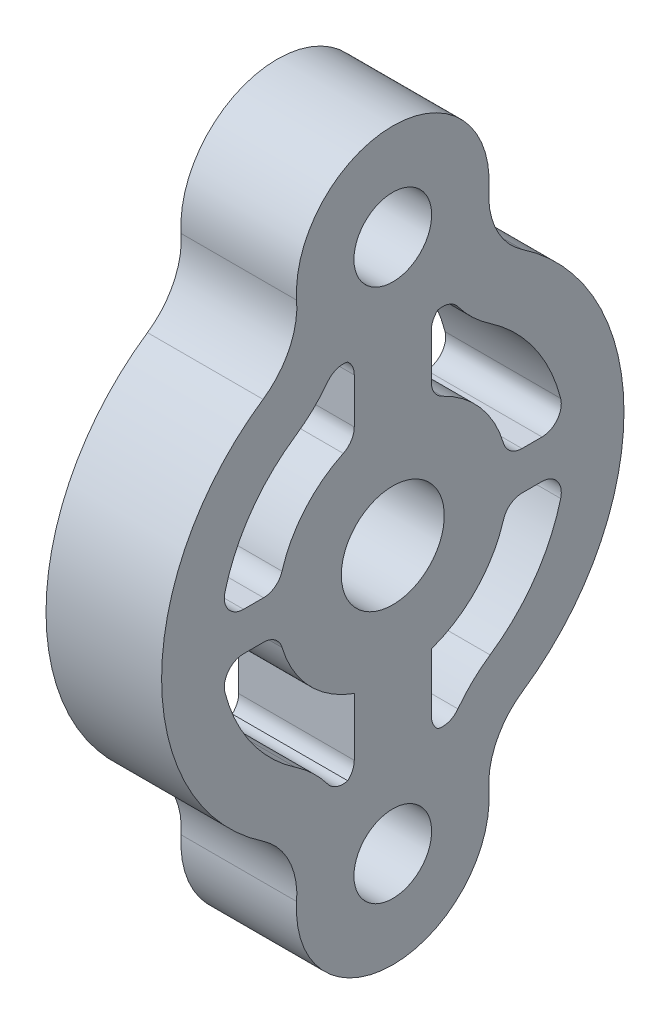
from build123d import *

# Parameters (mm, degrees)
SKETCH1_R           = 2.1209000000000002
SKETCH1_R_2         = 1.6002
BOSS_EXTRUDE1_DEPTH = 4.7625
CUT_EXTRUDE1_DEPTH  = 19.370370377662503
FILLET1_R           = 0.79375


with BuildPart() as part:
    # Sketch1 → Boss-Extrude1 (new body)
    with BuildSketch(Plane(origin=(0, 0, 0), x_dir=(0, 0, -1), z_dir=(1, 0, 0))):
        with BuildLine():
            ThreePointArc((-3.9594667824617957, 10.7287079782197), (2.8e-15, 14.96875), (3.9594667824617935, 10.728707978219694))
            ThreePointArc((3.9594667824617935, 10.728707978219694), (4.272672724168048, 9.121274682724051), (5.345280156323423, 7.883755770596593))
            ThreePointArc((5.345280156323423, 7.883755770596593), (9.525, 1.06e-15), (5.345280156323425, -7.883755770596589))
            ThreePointArc((5.345280156323425, -7.883755770596589), (4.272672724168048, -9.12127468272405), (3.9594667824617975, -10.728707978219694))
            ThreePointArc((3.9594667824617975, -10.728707978219694), (2.8e-15, -14.968749999999996), (-3.9594667824617917, -10.7287079782197))
            ThreePointArc((-3.9594667824617917, -10.7287079782197), (-4.272672724168042, -9.121274682724055), (-5.345280156323421, -7.883755770596593))
            ThreePointArc((-5.345280156323421, -7.883755770596593), (-9.524999999999999, -3.06e-15), (-5.345280156323423, 7.883755770596589))
            ThreePointArc((-5.345280156323423, 7.883755770596589), (-4.272672724168045, 9.121274682724053), (-3.9594667824617957, 10.7287079782197))
        make_face()
        with Locations(Location((0, 0, 0), (0, 0, 180))):
            Circle(SKETCH1_R, mode=Mode.SUBTRACT)
        with Locations(Location((0, 11, 0), (0, 0, 180))):
            Circle(SKETCH1_R_2, mode=Mode.SUBTRACT)
        with Locations(Location((0, -11, 0), (0, 0, 180))):
            Circle(SKETCH1_R_2, mode=Mode.SUBTRACT)
    extrude(amount=BOSS_EXTRUDE1_DEPTH)

    # Sketch2 → Cut-Extrude1 (cut, through all)
    with BuildSketch(Plane(origin=(4.7625, 0, 0), x_dir=(0, 0, -1), z_dir=(1, 0, 0))):
        with BuildLine():
            Line((-1.5875000000000001, -7.362580542128799), (-1.5874999999999997, -4.490128060534577))
            ThreePointArc((-1.5874999999999997, -4.490128060534577), (-3.6450027313013944, -3.0651853677722936), (-4.69588832783532, -0.7937500000000003))
            Line((-4.69588832783532, -0.7937500000000003), (-7.09951582856183, -0.7937500000000006))
            ThreePointArc((-7.09951582856183, -0.7937500000000006), (-6.115616956356625, -3.692207104920213), (-4.008960117242562, -5.912816827947443))
            ThreePointArc((-4.008960117242562, -5.912816827947443), (-3.046958974664247, -6.740089655613493), (-2.2977150650912916, -7.764033059168784))
            ThreePointArc((-2.2977150650912916, -7.764033059168784), (-1.9529503466198308, -7.545009188704331), (-1.5875000000000001, -7.362580542128799))
        make_face()
        with BuildLine():
            Line((1.5875000000000001, -7.362580542128799), (1.5874999999999997, -4.490128060534577))
            ThreePointArc((1.5874999999999997, -4.490128060534577), (3.645002731301394, -3.0651853677722944), (4.695888327835319, -0.7937500000000003))
            Line((4.695888327835319, -0.7937500000000003), (7.099515828561831, -0.7937500000000003))
            ThreePointArc((7.099515828561831, -0.7937500000000003), (6.115616956356629, -3.692207104920211), (4.008960117242569, -5.912816827947442))
            ThreePointArc((4.008960117242569, -5.912816827947442), (3.0469589746642507, -6.74008965561349), (2.2977150650912943, -7.764033059168785))
            ThreePointArc((2.2977150650912943, -7.764033059168785), (1.9529503466198321, -7.545009188704331), (1.5875000000000001, -7.362580542128799))
        make_face()
        with BuildLine():
            Line((-7.09951582856183, 0.7937500000000006), (-4.69588832783532, 0.7937500000000003))
            ThreePointArc((-4.69588832783532, 0.7937500000000003), (-3.6450027313013944, 3.0651853677722936), (-1.5874999999999997, 4.490128060534576))
            Line((-1.5874999999999997, 4.490128060534576), (-1.5875000000000004, 7.362580542128802))
            ThreePointArc((-1.5875000000000004, 7.362580542128802), (-1.9529503466198312, 7.545009188704334), (-2.297715065091291, 7.764033059168786))
            ThreePointArc((-2.297715065091291, 7.764033059168786), (-3.046958974664248, 6.74008965561349), (-4.008960117242567, 5.912816827947441))
            ThreePointArc((-4.008960117242567, 5.912816827947441), (-6.115616956356626, 3.692207104920211), (-7.09951582856183, 0.7937500000000006))
        make_face()
        with BuildLine():
            Line((1.5874999999999997, 4.490128060534576), (1.5875000000000004, 7.362580542128802))
            ThreePointArc((1.5875000000000004, 7.362580542128802), (1.9529503466198308, 7.545009188704333), (2.2977150650912908, 7.764033059168786))
            ThreePointArc((2.2977150650912908, 7.764033059168786), (3.04695897466425, 6.740089655613488), (4.0089601172425695, 5.912816827947439))
            ThreePointArc((4.0089601172425695, 5.912816827947439), (6.115616956356628, 3.6922071049202088), (7.09951582856183, 0.7937500000000001))
            Line((7.09951582856183, 0.7937500000000001), (4.695888327835319, 0.7937500000000003))
            ThreePointArc((4.695888327835319, 0.7937500000000003), (3.645002731301393, 3.0651853677722936), (1.5874999999999997, 4.490128060534576))
        make_face()
    extrude(amount=-CUT_EXTRUDE1_DEPTH, mode=Mode.SUBTRACT)

    # Fillet1
    # the kernel refuses this fillet: 0.79375 mm, written as the material it adds along each edge
    with BuildSketch(Plane(origin=(4.7625, -0.79375, -4.69588832783532), x_dir=(0, -0.9739846340944042, 0.2266140607905643), z_dir=(-1, 0, 0))) as fillet1_piece_1:
        with BuildLine():
            CenterArc((0.6306170426342453, -0.7922663309145631), FILLET1_R, 93.50374068607991, 73.39845040097973)
            Line((-0.14248326067818778, -0.612391420162052), (0, 0))
            ThreePointArc((0, 0), (0.2910540196773445, -0.00890201451262073), (0.5821080393546879, 2e-17))
        make_face()
    extrude(amount=4.7625)
    with BuildSketch(Plane(origin=(4.7625, -0.7937500000000003, -7.099515828561831), x_dir=(0, -1.2e-16, 1), z_dir=(-1, 0, 0))) as fillet1_piece_2:
        with BuildLine():
            CenterArc((0.9511547664575569, -0.79375), FILLET1_R, 90.00000000000001, 104.47751218592987)
            ThreePointArc((0.1826096336945221, -0.9921874999999994), (0.07376813927591291, -0.499321331749944), (0, 0))
            Line((0, 0), (0.9511547664575568, 0))
        make_face()
    extrude(amount=4.7625)
    with BuildSketch(Plane(origin=(4.7625, 0.7937500000000004, -7.099515828561831), x_dir=(0, 0.9834817412823682, 0.18100736052492677), z_dir=(-1, 0, 0))) as fillet1_piece_3:
        with BuildLine():
            CenterArc((0.9528046458700647, -0.7917687535280427), FILLET1_R, 85.95092901125643, 104.47751218592998)
            Line((0.17216601372718518, -0.9354433459447041), (0, 0))
            ThreePointArc((0, 0), (0.5044259889900348, 0.01783121824761195), (1.0088519779800686, 3e-17))
        make_face()
    extrude(amount=4.7625)
    with BuildSketch(Plane(origin=(4.7625, 0.7937500000000004, -4.69588832783532), x_dir=(0, -3.5e-16, -1), z_dir=(-1, 0, 0))) as fillet1_piece_4:
        with BuildLine():
            CenterArc((0.6287485435860521, -0.79375), FILLET1_R, 89.99999999999997, 73.39845040097973)
            ThreePointArc((-0.13191386661700052, -0.5669642857142849), (-0.05728650796072109, -0.2854994645150646), (0, 0))
            Line((0, 0), (0.6287485435860525, 0))
        make_face()
    extrude(amount=4.7625)
    with BuildSketch(Plane(origin=(4.7625, 4.490128060534577, -1.5875), x_dir=(0, -0.3814588594181724, -0.9243858169462505), z_dir=(-1, 0, 0))) as fillet1_piece_5:
        with BuildLine():
            CenterArc((0.531562729123544, -0.792696105792815), FILLET1_R, 92.95285644533071, 64.62306647484768)
            Line((-0.2021685130775424, -0.48991313612964066), (0, 0))
            ThreePointArc((0, 0), (0.24533664421086704, -0.00632336524311312), (0.4906732884217341, -2e-17))
        make_face()
    extrude(amount=4.7625)
    with BuildSketch(Plane(origin=(4.7625, 7.764033059168785, -2.2977150650912908), x_dir=(0, -0.5063837713427546, 0.8623082257062661), z_dir=(-1, 0, 0))) as fillet1_piece_6:
        with BuildLine():
            CenterArc((0.7539344065414385, -0.7907853062648578), FILLET1_R, 94.95360014564893, 78.58484225728135)
            ThreePointArc((-0.03477336431713144, -0.7014594159121466), (-0.00629236326442682, -0.35127968530901016), (0, 0))
            ThreePointArc((0, 0), (0.3426974575188369, -0.01482346867571009), (0.685394915037674, 1e-17))
        make_face()
    extrude(amount=4.7625)
    with BuildSketch(Plane(origin=(4.7625, 7.362580542128802, -1.5875000000000004), x_dir=(0, 0.4507075585568903, -0.892671662292294), z_dir=(-1, 0, 0))) as fillet1_piece_7:
        with BuildLine():
            CenterArc((0.4890515947139495, 0.7925039046242565), FILLET1_R, 206.78908923910086, 60.00000000000017)
            Line((-0.21950653723055963, 0.43475478001972634), (0, 0))
            ThreePointArc((0, 0), (0.22229617941543137, 0.00623047687871969), (0.44459235883086456, 0))
        make_face()
    extrude(amount=4.7625)
    with BuildSketch(Plane(origin=(4.7625, 4.490128060534576, 1.5875), x_dir=(0, 1, -4.2e-16), z_dir=(-1, 0, 0))) as fillet1_piece_8:
        with BuildLine():
            CenterArc((0.5299877249827253, -0.79375), FILLET1_R, 89.99999999999997, 64.62306647484775)
            ThreePointArc((-0.1871716729483179, -0.4535714285714287), (-0.08774060732805387, -0.22919781797903635), (0, 0))
            Line((0, 0), (0.5299877249827256, 0))
        make_face()
    extrude(amount=4.7625)
    with BuildSketch(Plane(origin=(4.7625, 7.362580542128802, 1.5875000000000004), x_dir=(0, 0.4507075585568887, 0.8926716622922948), z_dir=(-1, 0, 0))) as fillet1_piece_9:
        with BuildLine():
            CenterArc((0.4890515947139505, -0.7925039046242564), FILLET1_R, 93.21091076089908, 60.000000000000085)
            Line((-0.21950653723055885, -0.43475478001972667), (0, 0))
            ThreePointArc((0, 0), (0.22229617941543217, -0.0062304768787197), (0.4445923588308641, 3e-17))
        make_face()
    extrude(amount=4.7625)
    with BuildSketch(Plane(origin=(4.7625, 7.764033059168787, 2.2977150650912916), x_dir=(0, -0.8361785115671588, 0.5484573791948931), z_dir=(-1, 0, 0))) as fillet1_piece_10:
        with BuildLine():
            CenterArc((0.7524865660320088, -0.79216315106995), FILLET1_R, 93.62356396435027, 78.58484225726829)
            ThreePointArc((-0.03393532877352373, -0.6845542951589412), (-0.0021623763281384, -0.3430110883660692), (0, 0))
            ThreePointArc((0, 0), (0.3511603974816025, -0.01110794251034867), (0.7023207949632068, 0))
        make_face()
    extrude(amount=4.7625)
    with BuildSketch(Plane(origin=(4.7625, 0.7937500000000004, 4.69588832783532), x_dir=(0, 0.9739846340944044, -0.22661406079056337), z_dir=(-1, 0, 0))) as fillet1_piece_11:
        with BuildLine():
            CenterArc((0.6306170426342449, -0.7922663309145632), FILLET1_R, 93.50374068607998, 73.39845040097971)
            Line((-0.14248326067818828, -0.6123914201620527), (0, 0))
            ThreePointArc((0, 0), (0.29105401967734285, -0.00890201451262188), (0.5821080393546864, -1e-17))
        make_face()
    extrude(amount=4.7625)
    with BuildSketch(Plane(origin=(4.7625, -0.79375, 4.69588832783532), x_dir=(0, -7.1e-16, 1), z_dir=(-1, 0, 0))) as fillet1_piece_12:
        with BuildLine():
            CenterArc((0.6287485435860539, -0.79375), FILLET1_R, 90.00000000000004, 73.39845040097977)
            ThreePointArc((-0.13191386661699994, -0.5669642857142864), (-0.05728650796072168, -0.28549946451506575), (0, 0))
            Line((0, 0), (0.6287485435860534, 0))
        make_face()
    extrude(amount=4.7625)
    with BuildSketch(Plane(origin=(4.7625, 0.7937500000000007, 7.099515828561831), x_dir=(0, -3.5e-16, -1), z_dir=(-1, 0, 0))) as fillet1_piece_13:
        with BuildLine():
            CenterArc((0.9511547664575583, -0.79375), FILLET1_R, 89.99999999999997, 104.47751218592998)
            ThreePointArc((0.1826096336945243, -0.9921875000000004), (0.07376813927591445, -0.4993213317499442), (0, 0))
            Line((0, 0), (0.9511547664575586, 0))
        make_face()
    extrude(amount=4.7625)
    with BuildSketch(Plane(origin=(4.7625, -0.7937500000000006, 7.099515828561831), x_dir=(0, -0.9834817412823684, -0.18100736052492664), z_dir=(-1, 0, 0))) as fillet1_piece_14:
        with BuildLine():
            CenterArc((0.9528046458700652, -0.7917687535280429), FILLET1_R, 85.9509290112564, 104.47751218593004)
            Line((0.17216601372718549, -0.9354433459447042), (0, 0))
            ThreePointArc((0, 0), (0.5044259889900345, 0.01783121824761361), (1.0088519779800695, -1e-17))
        make_face()
    extrude(amount=4.7625)
    with BuildSketch(Plane(origin=(4.7625, -7.764033059168784, 2.2977150650912916), x_dir=(0, 0.5063837713427585, -0.862308225706264), z_dir=(-1, 0, 0))) as fillet1_piece_15:
        with BuildLine():
            CenterArc((0.7539344065414401, -0.7907853062648579), FILLET1_R, 94.95360014564929, 78.58484225728117)
            ThreePointArc((-0.03477336431713059, -0.7014594159121491), (-0.00629236326442512, -0.35127968530901216), (0, 0))
            ThreePointArc((0, 0), (0.34269745751883435, -0.01482346867571016), (0.6853949150376707, 0))
        make_face()
    extrude(amount=4.7625)
    with BuildSketch(Plane(origin=(4.7625, -7.362580542128798, 1.5875000000000004), x_dir=(0, -0.4507075585568874, 0.8926716622922954), z_dir=(-1, 0, 0))) as fillet1_piece_16:
        with BuildLine():
            CenterArc((0.48905159471395165, 0.7925039046242556), FILLET1_R, 206.78908923910083, 59.99999999999994)
            Line((-0.2195065372305578, 0.43475478001972623), (0, 0))
            ThreePointArc((0, 0), (0.22229617941543278, 0.00623047687871768), (0.4445923588308635, 1e-17))
        make_face()
    extrude(amount=4.7625)
    with BuildSketch(Plane(origin=(4.7625, -7.362580542128799, -1.5875000000000004), x_dir=(0, -0.4507075585568885, -0.8926716622922948), z_dir=(-1, 0, 0))) as fillet1_piece_17:
        with BuildLine():
            CenterArc((0.4890515947139506, -0.7925039046242561), FILLET1_R, 93.21091076089908, 60.00000000000003)
            Line((-0.21950653723055835, -0.4347547800197259), (0, 0))
            ThreePointArc((0, 0), (0.22229617941543273, -0.00623047687871996), (0.4445923588308643, 1e-17))
        make_face()
    extrude(amount=4.7625)
    with BuildSketch(Plane(origin=(4.7625, -7.764033059168785, -2.297715065091294), x_dir=(0, 0.8361785115671573, -0.5484573791948956), z_dir=(-1, 0, 0))) as fillet1_piece_18:
        with BuildLine():
            CenterArc((0.7524865660320036, -0.7921631510699503), FILLET1_R, 93.62356396435017, 78.58484225726816)
            ThreePointArc((-0.03393532877352819, -0.6845542951589385), (-0.00216237632813965, -0.343011088366068), (0, 0))
            ThreePointArc((0, 0), (0.35116039748160127, -0.01110794251034834), (0.7023207949632029, 3e-17))
        make_face()
    extrude(amount=4.7625)


solid = part.part
